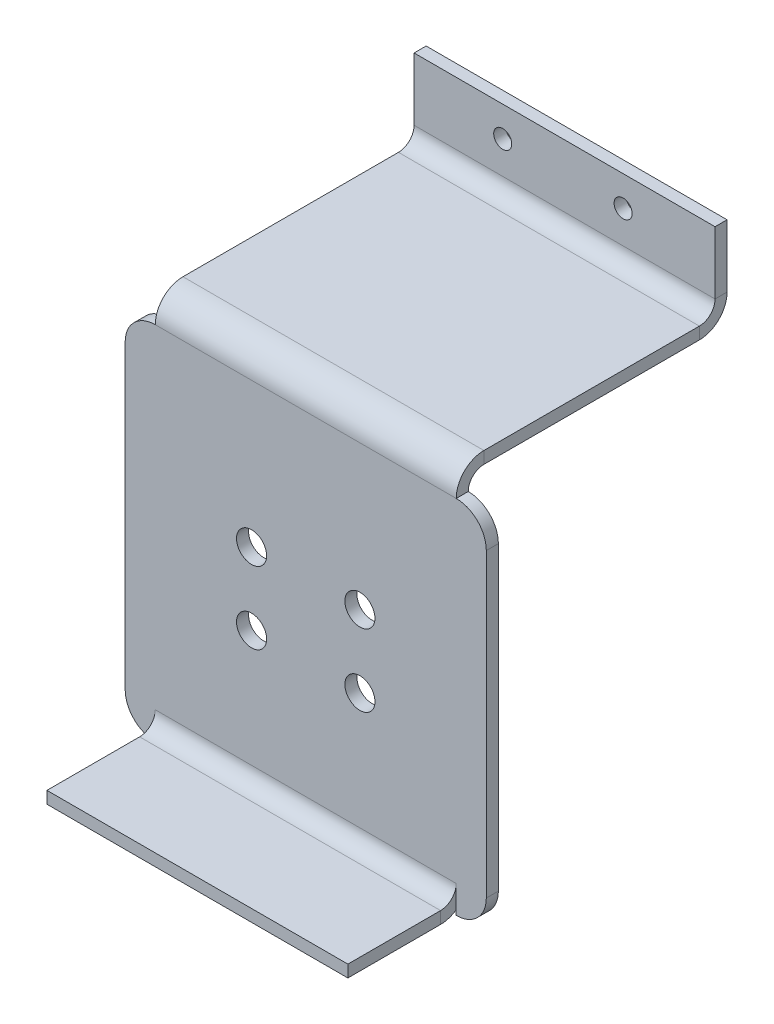
from build123d import *

# Parameters (mm, degrees)
BASE_FLANGE2_DEPTH           = 2
EDGE_FLANGE1_DEPTH           = 50
EDGE_FLANGE2_STRIP_W         = 13.2
EDGE_FLANGE2_STRIP_H         = 2
EDGE_FLANGE2_STRIP_CUT_DEPTH = 50
EDGE_FLANGE2_DEPTH           = 50
SKETCH18_R                   = 1.5
CUT_EXTRUDE1_DEPTH           = 10
EDGE_FLANGE3_STRIP_W         = 13.2
EDGE_FLANGE3_STRIP_H         = 2
EDGE_FLANGE3_STRIP_CUT_DEPTH = 50
EDGE_FLANGE3_DEPTH           = 50


# Sheet-metal steps are written as plain solids
with BuildPart() as part:
    # Sketch1 → Base-Flange2 (new body)
    with BuildSketch(Plane.XY):
        with BuildLine():
            Line((25.272889038, 31.228000671), (-24.727110962, 31.228000671))
            ThreePointArc((-24.727110962, 31.228000671), (-28.262644868, 29.763534577), (-29.727110962, 26.228000671))
            Line((-29.727110962, 26.228000671), (-29.727110962, -23.771999329))
            ThreePointArc((-29.727110962, -23.771999329), (-28.262644868, -27.307533234), (-24.727110962, -28.771999329))
            Line((-24.727110962, -28.771999329), (25.272889038, -28.771999329))
            ThreePointArc((25.272889038, -28.771999329), (28.808422944, -27.307533234), (30.272889038, -23.771999329))
            Line((30.272889038, -23.771999329), (30.272889038, 26.228000671))
            ThreePointArc((30.272889038, 26.228000671), (28.808422944, 29.763534577), (25.272889038, 31.228000671))
        make_face()
        with BuildLine():
            ThreePointArc((11.772817004, -4.771999329), (11.040605056, -3.004283311), (9.272889038, -2.272071362))
            ThreePointArc((9.272889038, -2.272071362), (7.505173021, -3.004283311), (6.772961072, -4.771999329))
            ThreePointArc((6.772961072, -4.771999329), (9.272889038, -7.271927295), (11.772817004, -4.771999329))
        make_face(mode=Mode.SUBTRACT)
        with BuildLine():
            ThreePointArc((-8.727110962, -2.272071362), (-10.494826979, -3.004283311), (-11.227038928, -4.771999329))
            ThreePointArc((-11.227038928, -4.771999329), (-8.727110962, -7.271927295), (-6.227182996, -4.771999329))
            ThreePointArc((-6.227182996, -4.771999329), (-6.959394944, -3.004283311), (-8.727110962, -2.272071362))
        make_face(mode=Mode.SUBTRACT)
        with BuildLine():
            ThreePointArc((6.772961072, 7.228000671), (9.272889038, 4.728072705), (11.772817004, 7.228000671))
            ThreePointArc((11.772817004, 7.228000671), (11.040605056, 8.995716689), (9.272889038, 9.727928638))
            ThreePointArc((9.272889038, 9.727928638), (7.505173021, 8.995716689), (6.772961072, 7.228000671))
        make_face(mode=Mode.SUBTRACT)
        with BuildLine():
            ThreePointArc((-8.727110962, 9.727928638), (-10.494826979, 8.995716689), (-11.227038928, 7.228000671))
            ThreePointArc((-11.227038928, 7.228000671), (-8.727110962, 4.728072705), (-6.227182996, 7.228000671))
            ThreePointArc((-6.227182996, 7.228000671), (-6.959394944, 8.995716689), (-8.727110962, 9.727928638))
        make_face(mode=Mode.SUBTRACT)
    extrude(amount=-BASE_FLANGE2_DEPTH)

    # Edge-Flange1 section (across the edge) → Edge-Flange1 (add)
    with BuildSketch(Plane(origin=(-24.727110962, 33.828000671, -2), x_dir=(0, -1, 0), z_dir=(1, 0, 0))):
        with BuildLine():
            Line((-2, 2.6), (-2, 43))
            Line((-2, 43), (0, 43))
            Line((0, 43), (0, 2.6))
            ThreePointArc((0, 2.6), (0.761522369, 0.761522369), (2.6, 0))
            Line((2.6, 0), (2.6, -2))
            ThreePointArc((2.6, -2), (-0.652691193, -0.652691193), (-2, 2.6))
        make_face()
    extrude(amount=EDGE_FLANGE1_DEPTH)

    # Edge-Flange2 strip (across the edge) → Edge-Flange2 strip cut (cut)
    with BuildSketch(Plane(origin=(25.272889038, 35.828000671, -45), x_dir=(0, 0, 1), z_dir=(-1, 0, 0))):
        with Locations((-2, -1)):
            Rectangle(EDGE_FLANGE2_STRIP_W, EDGE_FLANGE2_STRIP_H)
    extrude(amount=EDGE_FLANGE2_STRIP_CUT_DEPTH, mode=Mode.SUBTRACT)

    # Edge-Flange2 section (across the edge) → Edge-Flange2 (add)
    with BuildSketch(Plane(origin=(25.272889038, 35.828000671, -45), x_dir=(0, 0, 1), z_dir=(-1, 0, 0))):
        with BuildLine():
            Line((0, 2.6), (0, 13))
            Line((0, 13), (2, 13))
            Line((2, 13), (2, 2.6))
            ThreePointArc((2, 2.6), (2.761522369, 0.761522369), (4.6, 0))
            Line((4.6, 0), (4.6, -2))
            ThreePointArc((4.6, -2), (1.347308807, -0.652691193), (0, 2.6))
        make_face()
    extrude(amount=EDGE_FLANGE2_DEPTH)

    # Sketch18 → Cut-Extrude1 (cut)
    with BuildSketch(Plane(origin=(0, 0, -45), x_dir=(-1, 0, 0), z_dir=(0, 0, -1))):
        with Locations((-10, 43.828000671)):
            Circle(SKETCH18_R)
        with Locations((10, 43.828000671)):
            Circle(SKETCH18_R)
    extrude(amount=-CUT_EXTRUDE1_DEPTH, mode=Mode.SUBTRACT)

    # Edge-Flange3 strip (across the edge) → Edge-Flange3 strip cut (cut)
    with BuildSketch(Plane(origin=(-24.727110962, -28.771999329, 0), x_dir=(0, 1, 0), z_dir=(1, 0, 0))):
        with Locations((-2, -1)):
            Rectangle(EDGE_FLANGE3_STRIP_W, EDGE_FLANGE3_STRIP_H)
    extrude(amount=EDGE_FLANGE3_STRIP_CUT_DEPTH, mode=Mode.SUBTRACT)

    # Edge-Flange3 section (across the edge) → Edge-Flange3 (add)
    with BuildSketch(Plane(origin=(-24.727110962, -28.771999329, 0), x_dir=(0, 1, 0), z_dir=(1, 0, 0))):
        with BuildLine():
            Line((0, 2.6), (0, 18))
            Line((0, 18), (2, 18))
            Line((2, 18), (2, 2.6))
            ThreePointArc((2, 2.6), (2.761522369, 0.761522369), (4.6, 0))
            Line((4.6, 0), (4.6, -2))
            ThreePointArc((4.6, -2), (1.347308807, -0.652691193), (0, 2.6))
        make_face()
    extrude(amount=EDGE_FLANGE3_DEPTH)


solid = part.part
